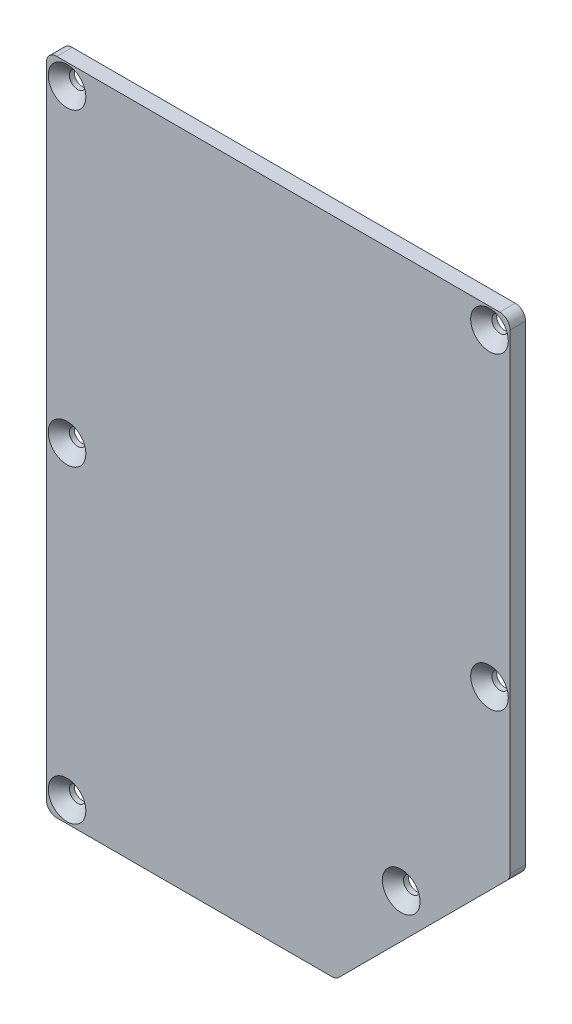
from build123d import *

# Parameters (mm, degrees)
BOSS_EXTRUDE1_DEPTH                                 = 3
CSK_FOR_M3_COUNTERSUNK_FLAT_HEAD_SCREW1_D           = 3.2
CSK_FOR_M3_COUNTERSUNK_FLAT_HEAD_SCREW1_DEPTH       = 5
CSK_FOR_M3_COUNTERSUNK_FLAT_HEAD_SCREW1_CSINK_D     = 7.3
CSK_FOR_M3_COUNTERSUNK_FLAT_HEAD_SCREW1_CSINK_ANGLE = 90
CSK_FOR_M3_COUNTERSUNK_FLAT_HEAD_SCREW1_TIP         = 0.96137699


with BuildPart() as part:
    # Sketch1 → Boss-Extrude1 (new body)
    with BuildSketch(Plane.XY):
        with BuildLine():
            Line((-45, 66), (-45, -58))
            ThreePointArc((-45, -58), (-44.414213562, -59.414213562), (-43, -60))
            Line((-43, -60), (10.384776311, -60))
            ThreePointArc((10.384776311, -60), (11.150143176, -59.847759065), (11.798989873, -59.414213562))
            Line((11.798989873, -59.414213562), (44.414213562, -26.798989873))
            ThreePointArc((44.414213562, -26.798989873), (44.847759065, -26.150143176), (45, -25.384776311))
            Line((45, -25.384776311), (45, 66))
            ThreePointArc((45, 66), (44.414213562, 67.414213562), (43, 68))
            Line((43, 68), (-43, 68))
            ThreePointArc((-43, 68), (-44.414213562, 67.414213562), (-45, 66))
        make_face()
    extrude(amount=BOSS_EXTRUDE1_DEPTH)

    # CSK for M3 Countersunk Flat Head Screw1
    with Locations(Plane(origin=(-41, -56, 3), x_dir=(1, 0, 0), z_dir=(0, 0, 1))):
        with Locations((0, 0), (64.863961031, 17.136038969), (82, 60), (0, 60), (0, 120), (82, 120)):
            CounterSinkHole(CSK_FOR_M3_COUNTERSUNK_FLAT_HEAD_SCREW1_D / 2, CSK_FOR_M3_COUNTERSUNK_FLAT_HEAD_SCREW1_CSINK_D / 2, depth=CSK_FOR_M3_COUNTERSUNK_FLAT_HEAD_SCREW1_DEPTH, counter_sink_angle=CSK_FOR_M3_COUNTERSUNK_FLAT_HEAD_SCREW1_CSINK_ANGLE)
            with Locations((0, 0, -(CSK_FOR_M3_COUNTERSUNK_FLAT_HEAD_SCREW1_DEPTH + CSK_FOR_M3_COUNTERSUNK_FLAT_HEAD_SCREW1_TIP / 2))):  # 118° drill point
                Cone(0, CSK_FOR_M3_COUNTERSUNK_FLAT_HEAD_SCREW1_D / 2, CSK_FOR_M3_COUNTERSUNK_FLAT_HEAD_SCREW1_TIP, mode=Mode.SUBTRACT)


solid = part.part
